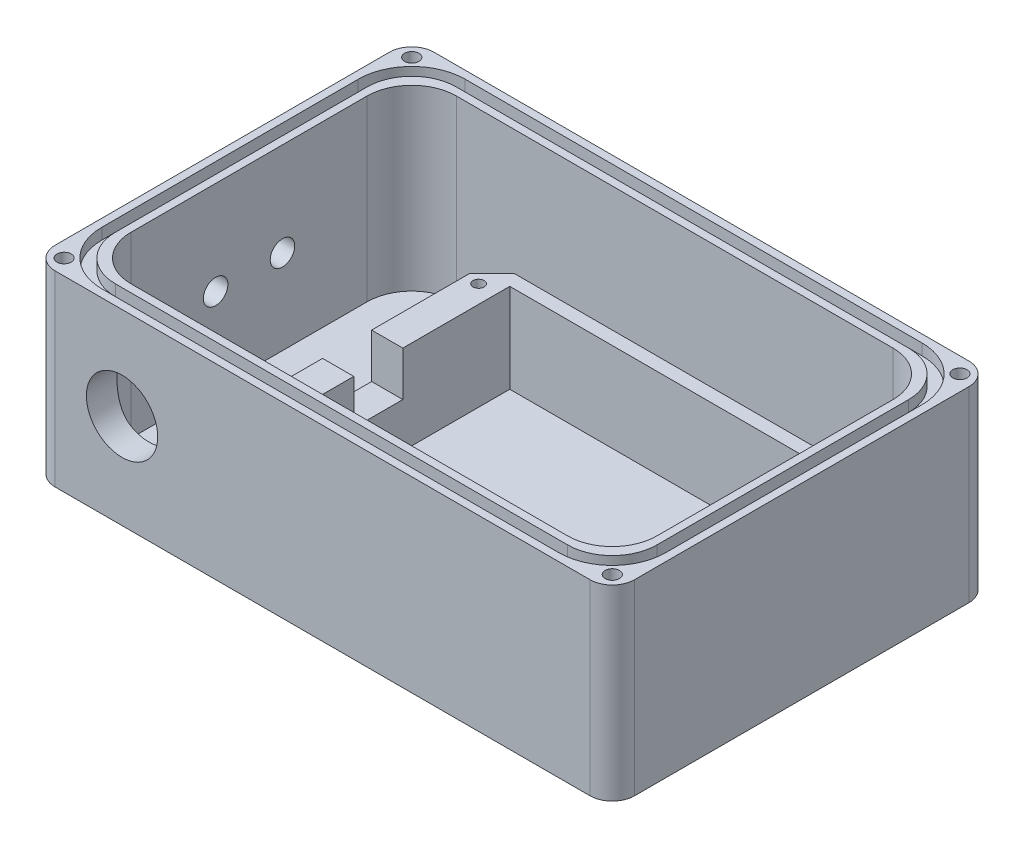
from build123d import *

# Parameters (mm, degrees)
SKETCH1_W           = 130
SKETCH1_H           = 85
BOSS_EXTRUDE1_DEPTH = 2
SKETCH2_W           = 130
SKETCH2_H           = 85
BOSS_EXTRUDE2_DEPTH = 40
FILLET1_R           = 5
FILLET2_R           = 5
CUT_EXTRUDE1_DEPTH  = 2.5
SKETCH5_R           = 1.25
SKETCH5_W           = 70
SKETCH5_H           = 59
BOSS_EXTRUDE4_DEPTH = 20
CUT_EXTRUDE3_REACH  = 162.901
SKETCH8_R           = 8
CUT_EXTRUDE4_REACH  = 162.901
SKETCH9_R           = 2.75
SKETCH10_R          = 1.6
CUT_EXTRUDE5_DEPTH  = 10
SKETCH11_W          = 7
SKETCH11_H          = 11
CUT_EXTRUDE6_DEPTH  = 10
SKETCH12_R          = 11
SKETCH12_R_2        = 8.406518552
CUT_EXTRUDE7_DEPTH  = 2


with BuildPart() as part:
    # Sketch1 → Boss-Extrude1 (new body)
    with BuildSketch(Plane(origin=(0, 0, 0), x_dir=(1, 0, 0), z_dir=(0, 1, 0))):
        with Locations((65, 42.5)):
            Rectangle(SKETCH1_W, SKETCH1_H)
    extrude(amount=BOSS_EXTRUDE1_DEPTH)

    # Sketch2 → Boss-Extrude2 (add)
    with BuildSketch(Plane(origin=(0, 2, 0), x_dir=(1, 0, 0), z_dir=(0, 1, 0))):
        with Locations((65, 42.5)):
            Rectangle(SKETCH2_W, SKETCH2_H)
        with BuildLine():
            Line((16, 79), (114, 79))
            ThreePointArc((114, 79), (121.071067812, 76.071067812), (124, 69))
            Line((124, 69), (124, 16))
            ThreePointArc((124, 16), (121.071067812, 8.928932188), (114, 6))
            Line((114, 6), (16, 6))
            ThreePointArc((16, 6), (8.928932188, 8.928932188), (6, 16))
            Line((6, 16), (6, 69))
            ThreePointArc((6, 69), (8.928932188, 76.071067812), (16, 79))
        make_face(mode=Mode.SUBTRACT)
    extrude(amount=BOSS_EXTRUDE2_DEPTH)

    # Fillet1
    fillet1_edges = [part.edges().sort_by_distance(p)[0] for p in [
        (0, 21, 0),
    ]]
    fillet(fillet1_edges, radius=FILLET1_R)

    # Fillet2
    fillet2_edges = [part.edges().sort_by_distance(p)[0] for p in [
        (0, 21, -85),
        (130, 21, -85),
        (130, 21, 0),
    ]]
    fillet(fillet2_edges, radius=FILLET2_R)

    # Sketch3 → Cut-Extrude1 (cut)
    with BuildSketch(Plane(origin=(0, 42, 0), x_dir=(1, 0, 0), z_dir=(0, 1, 0))):
        with BuildLine():
            Line((13.75, 83.25), (116.25, 83.25))
            ThreePointArc((116.25, 83.25), (124.735281374, 79.735281374), (128.25, 71.25))
            Line((128.25, 71.25), (128.25, 13.75))
            ThreePointArc((128.25, 13.75), (124.735281374, 5.264718626), (116.25, 1.75))
            Line((116.25, 1.75), (13.75, 1.75))
            ThreePointArc((13.75, 1.75), (5.264718626, 5.264718626), (1.75, 13.75))
            Line((1.75, 13.75), (1.75, 71.25))
            ThreePointArc((1.75, 71.25), (5.264718626, 79.735281374), (13.75, 83.25))
        make_face()
        with BuildLine():
            Line((4.25, 70.75), (4.25, 14.25))
            ThreePointArc((4.25, 14.25), (7.178932188, 7.178932188), (14.25, 4.25))
            Line((14.25, 4.25), (115.75, 4.25))
            ThreePointArc((115.75, 4.25), (122.821067812, 7.178932188), (125.75, 14.25))
            Line((125.75, 14.25), (125.75, 70.75))
            ThreePointArc((125.75, 70.75), (122.821067812, 77.821067812), (115.75, 80.75))
            Line((115.75, 80.75), (14.25, 80.75))
            ThreePointArc((14.25, 80.75), (7.178932188, 77.821067812), (4.25, 70.75))
        make_face(mode=Mode.SUBTRACT)
    extrude(amount=-CUT_EXTRUDE1_DEPTH, mode=Mode.SUBTRACT)

    # Sketch5 → Boss-Extrude4 (add)
    with BuildSketch(Plane(origin=(0, 2, 0), x_dir=(1, 0, 0), z_dir=(0, 1, 0))):
        Polygon((32, 66), (37, 71), (110.85, 71), (115.85, 66), (115.85, 11), (110.85, 6), (37, 6), (32, 11), align=None)
        with Locations((35, 65)):
            Circle(SKETCH5_R, mode=Mode.SUBTRACT)
        with Locations((35, 12)):
            Circle(SKETCH5_R, mode=Mode.SUBTRACT)
        with Locations((112.991794233, 13.131385125)):
            Circle(SKETCH5_R, mode=Mode.SUBTRACT)
        with Locations((113, 61.131384424)):
            Circle(SKETCH5_R, mode=Mode.SUBTRACT)
        with Locations((74, 38.5)):
            Rectangle(SKETCH5_W, SKETCH5_H, mode=Mode.SUBTRACT)
    extrude(amount=BOSS_EXTRUDE4_DEPTH)

    # Sketch8 → Cut-Extrude3 (cut, up to next)
    with BuildSketch(Plane.XY, mode=Mode.PRIVATE) as cut_extrude3_sk1:
        with Locations((20, 21.254793077)):
            Circle(SKETCH8_R)
    cut_extrude3_tool1 = extrude(cut_extrude3_sk1.sketch, amount=-CUT_EXTRUDE3_REACH, mode=Mode.PRIVATE) & part.part
    add(cut_extrude3_tool1.solids().sort_by_distance((20, 21.254793, 0))[0], mode=Mode.SUBTRACT)

    # Sketch9 → Cut-Extrude4 (cut, up to next)
    with BuildSketch(Plane.ZY, mode=Mode.PRIVATE) as cut_extrude4_sk1:
        with Locations((-50, 21)):
            Circle(SKETCH9_R)
    cut_extrude4_tool1 = extrude(cut_extrude4_sk1.sketch, amount=-CUT_EXTRUDE4_REACH, mode=Mode.PRIVATE) & part.part
    # Sketch9 → Cut-Extrude4 (cut, up to next)
    with BuildSketch(Plane.ZY, mode=Mode.PRIVATE) as cut_extrude4_sk2:
        with Locations((-35, 21)):
            Circle(SKETCH9_R)
    cut_extrude4_tool2 = extrude(cut_extrude4_sk2.sketch, amount=-CUT_EXTRUDE4_REACH, mode=Mode.PRIVATE) & part.part
    add(cut_extrude4_tool1.solids().sort_by_distance((0, 21, -50))[0], mode=Mode.SUBTRACT)
    add(cut_extrude4_tool2.solids().sort_by_distance((0, 21, -35))[0], mode=Mode.SUBTRACT)

    # Sketch10 → Cut-Extrude5 (cut)
    with BuildSketch(Plane(origin=(0, 42, 0), x_dir=(1, 0, 0), z_dir=(0, 1, 0))):
        with Locations((3.5, 81.5)):
            Circle(SKETCH10_R)
        with Locations((3.5, 3.5)):
            Circle(SKETCH10_R)
        with Locations((126.5, 3.5)):
            Circle(SKETCH10_R)
        with Locations((126.5, 81.5)):
            Circle(SKETCH10_R)
    extrude(amount=-CUT_EXTRUDE5_DEPTH, mode=Mode.SUBTRACT)

    # Sketch11 → Cut-Extrude6 (cut)
    with BuildSketch(Plane(origin=(0, 22, 0), x_dir=(1, 0, 0), z_dir=(0, 1, 0))):
        with Locations((35.5, 38.5)):
            Rectangle(SKETCH11_W, SKETCH11_H)
    extrude(amount=-CUT_EXTRUDE6_DEPTH, mode=Mode.SUBTRACT)

    # Sketch12 → Cut-Extrude7 (cut)
    with BuildSketch(Plane(origin=(0, 0, -6), x_dir=(-1, 0, 0), z_dir=(0, 0, -1))):
        with Locations((-19.95237835, 21)):
            Circle(SKETCH12_R)
        with Locations((-19.95237835, 21)):
            Circle(SKETCH12_R_2, mode=Mode.SUBTRACT)
    extrude(amount=CUT_EXTRUDE7_DEPTH, mode=Mode.SUBTRACT)


solid = part.part
